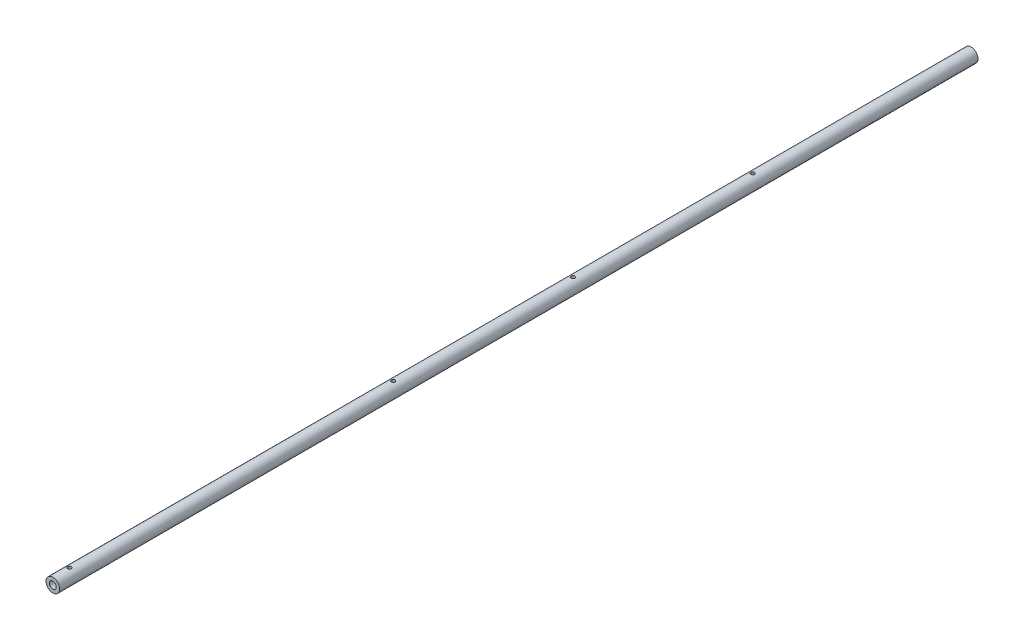
from build123d import *

# Parameters (mm, degrees)
SKETCH1_R        = 7.8613
SKETCH1_R_2      = 3.93065
ROD_DEPTH        = 1054.1
HOLES_DEPTH      = 1055.158626619
HOLES_DEPTH_BACK = 1055.158626619
SKETCH3_R        = 2.1082


with BuildPart() as part:
    # Sketch1 → Rod (new body)
    with BuildSketch(Plane.XY):
        Circle(SKETCH1_R)
        Circle(SKETCH1_R_2, mode=Mode.SUBTRACT)
    extrude(amount=ROD_DEPTH)

    # Sketch3 → Holes (cut, two sides: drawn at the far end of the back side and taken through both)
    with BuildSketch(Plane(origin=(0, 0, 0), x_dir=(1, 0, 0), z_dir=(0, 1, 0)).offset(-HOLES_DEPTH_BACK)):
        with Locations((0, -250.825)):
            Circle(SKETCH3_R)
        with Locations((0, -457.2)):
            Circle(SKETCH3_R)
        with Locations((0, -663.575)):
            Circle(SKETCH3_R)
        with Locations((0, -1035.05)):
            Circle(SKETCH3_R)
    extrude(amount=HOLES_DEPTH + HOLES_DEPTH_BACK, mode=Mode.SUBTRACT)


solid = part.part
